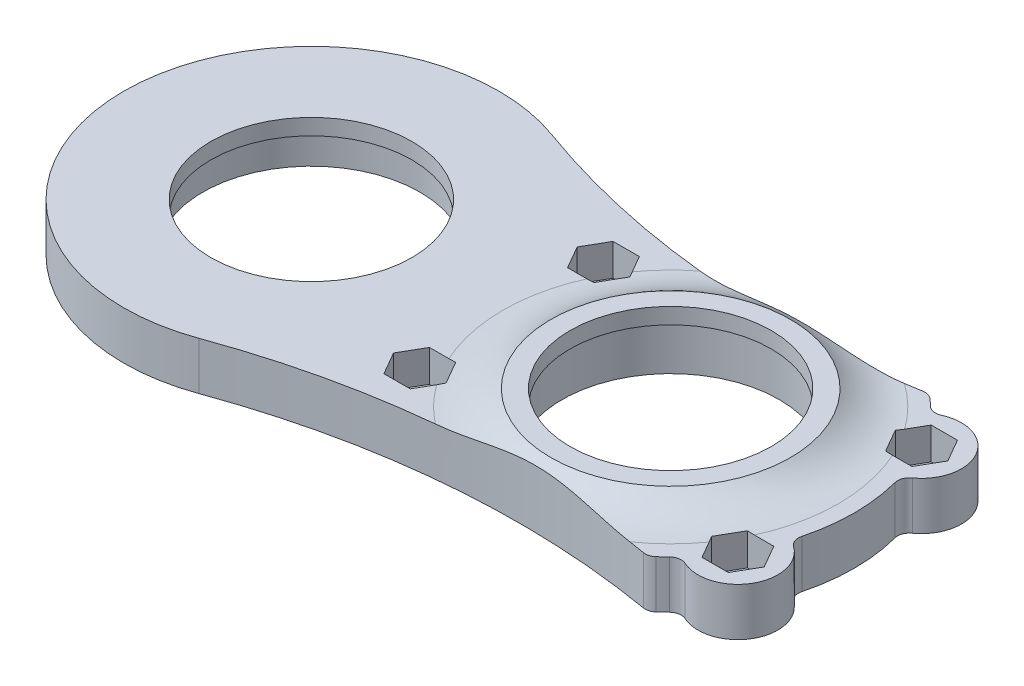
from build123d import *

# Parameters (mm, degrees)
SKETCH_1_R               = 23
SKETCH_1_R_2             = 13.6
SKETCH_1_R_3             = 5
EXTRUDE_1_DEPTH          = 6
CUT_EXTRUDE_1_DEPTH      = 14
PATTERN_CIRCULAR_1_COUNT = 2
CUT_EXTRUDE_START        = -7
CUT_EXTRUDE_2_DEPTH      = 7
FILLET_1_R               = 1.5
CUT_EXTRUDE_4_DEPTH      = 4
PATTERN_CIRCULAR_2_COUNT = 6
SKETCH_9_R               = 13.6
SKETCH_9_R_2             = 12.6
EXTRUDE_5_DEPTH          = 2
EXTRUDE_START            = -6
SKETCH_12_R              = 13.6
EXTRUDE_6_DEPTH          = 6
CUT_EXTRUDE_5_DEPTH      = 10
SKETCH_17_R              = 13.6
SKETCH_17_R_2            = 12.6
EXTRUDE_7_DEPTH          = 2
EXTRUDE_START_2          = 2
SKETCH_18_R              = 15
SKETCH_18_R_2            = 13.6
EXTRUDE_8_DEPTH          = 2
SKETCH_19_R              = 13.6
CUT_EXTRUDE_6_DEPTH      = 2
SKETCH_20_R              = 13.6
SKETCH_20_R_2            = 12.6
EXTRUDE_9_DEPTH          = 2
FILLET_2_R               = 10


with BuildPart() as part:
    # 草图1 → 凸台-拉伸1 (new body)
    # profile 1 of 5: a face of its own
    with BuildSketch(Plane(origin=(0, 0, 0), x_dir=(1, 0, 0), z_dir=(0, 1, 0))):
        Circle(SKETCH_1_R)
        with Locations(Location((0, 0, 0), (0, 0, 270))):
            Circle(SKETCH_1_R_2, mode=Mode.SUBTRACT)
    # profile 2 of 5: a face of its own
    with BuildSketch(Plane(origin=(0, 0, 0), x_dir=(1, 0, 0), z_dir=(0, 1, 0))):
        with Locations((-19.918584287, -11.5)):
            Circle(SKETCH_1_R_3)
    # profile 3 of 5: a face of its own
    with BuildSketch(Plane(origin=(0, 0, 0), x_dir=(1, 0, 0), z_dir=(0, 1, 0))):
        with Locations((19.918584287, -11.5)):
            Circle(SKETCH_1_R_3)
    # profile 4 of 5: a face of its own
    with BuildSketch(Plane(origin=(0, 0, 0), x_dir=(1, 0, 0), z_dir=(0, 1, 0))):
        with Locations((19.918584287, 11.5)):
            Circle(SKETCH_1_R_3)
    # profile 5 of 5: a face of its own
    with BuildSketch(Plane(origin=(0, 0, 0), x_dir=(1, 0, 0), z_dir=(0, 1, 0))):
        with Locations((-19.918584287, 11.5)):
            Circle(SKETCH_1_R_3)
    extrude(amount=-EXTRUDE_1_DEPTH)

    # 草图2 → 切除-拉伸1 (cut)
    with BuildSketch(Plane.XZ.offset(6)):
        with BuildLine():
            ThreePointArc((-19.918584287, 9.9), (-18.787213437, 10.36862915), (-18.318584287, 11.5))
            Line((-18.318584287, 11.5), (-19.918584287, 11.5))
            Line((-19.918584287, 11.5), (-19.918584287, 9.9))
        make_face()
        with BuildLine():
            Line((-19.918584287, 11.5), (-18.318584287, 11.5))
            ThreePointArc((-18.318584287, 11.5), (-21.049955137, 12.63137085), (-19.918584287, 9.9))
            Line((-19.918584287, 9.9), (-19.918584287, 11.5))
        make_face()
        with BuildLine():
            ThreePointArc((-19.918584287, 9.9), (-18.787213437, 10.36862915), (-18.318584287, 11.5))
            Line((-18.318584287, 11.5), (-19.918584287, 11.5))
            Line((-19.918584287, 11.5), (-19.918584287, 9.9))
        make_face()
        with BuildLine():
            Line((-19.918584287, 11.5), (-18.318584287, 11.5))
            ThreePointArc((-18.318584287, 11.5), (-21.049955137, 12.63137085), (-19.918584287, 9.9))
            Line((-19.918584287, 9.9), (-19.918584287, 11.5))
        make_face()
        with BuildLine():
            ThreePointArc((-19.918584287, -9.9), (-21.049955137, -12.63137085), (-18.318584287, -11.5))
            Line((-18.318584287, -11.5), (-19.918584287, -11.5))
            Line((-19.918584287, -11.5), (-19.918584287, -9.9))
        make_face()
        with BuildLine():
            Line((-19.918584287, -11.5), (-18.318584287, -11.5))
            ThreePointArc((-18.318584287, -11.5), (-18.787213437, -10.36862915), (-19.918584287, -9.9))
            Line((-19.918584287, -9.9), (-19.918584287, -11.5))
        make_face()
        with BuildLine():
            ThreePointArc((-19.918584287, -9.9), (-21.049955137, -12.63137085), (-18.318584287, -11.5))
            Line((-18.318584287, -11.5), (-19.918584287, -11.5))
            Line((-19.918584287, -11.5), (-19.918584287, -9.9))
        make_face()
        with BuildLine():
            Line((-19.918584287, -11.5), (-18.318584287, -11.5))
            ThreePointArc((-18.318584287, -11.5), (-18.787213437, -10.36862915), (-19.918584287, -9.9))
            Line((-19.918584287, -9.9), (-19.918584287, -11.5))
        make_face()
    cut_extrude_1 = extrude(amount=-CUT_EXTRUDE_1_DEPTH, mode=Mode.SUBTRACT)

    # 阵列(圆周)1: 切除-拉伸1 ×2 about axis
    pattern_circular_1_axis = Axis((0, 0, 0), (0, 1, 0))
    for i in range(1, PATTERN_CIRCULAR_1_COUNT):
        add(cut_extrude_1.rotate(pattern_circular_1_axis, i * 360 / PATTERN_CIRCULAR_1_COUNT), mode=Mode.SUBTRACT)

    # 草图3 → 切除-拉伸2 (cut)
    with BuildSketch(Plane.XZ.offset(6).offset(CUT_EXTRUDE_START)):
        with BuildLine():
            ThreePointArc((14.774295945, 17.627256716), (-0.556308738, 22.993271202), (-15.609472524, 16.892139223))
            ThreePointArc((-15.609472524, 16.892139223), (-0.389497448, 16.098651419), (14.774295945, 17.627256716))
        make_face()
        with BuildLine():
            ThreePointArc((-15.609472524, -16.892139223), (-0.556308738, -22.993271202), (14.774295945, -17.627256716))
            ThreePointArc((14.774295945, -17.627256716), (-0.389497448, -16.098651419), (-15.609472524, -16.892139223))
        make_face()
    extrude(amount=CUT_EXTRUDE_2_DEPTH, mode=Mode.SUBTRACT)

    # 圆角1
    fillet_1_edges = [part.edges().sort_by_distance(p)[0] for p in [
        (16.962730619, -3, 15.532732212),
        (-16.962730619, -3, 15.532732212),
        (-21.933105995, -3, 6.923789527),
        (-21.933105995, -3, -6.923789527),
        (-16.962730619, -3, -15.532732212),
        (16.962730619, -3, -15.532732212),
        (21.933105995, -3, -6.923789527),
        (21.933105995, -3, 6.923789527),
        (-15.609472524, -3, 16.892139223),
        (14.774295945, -3, 17.627256716),
        (14.774295945, -3, -17.627256716),
        (-15.609472524, -3, -16.892139223),
    ]]
    fillet(fillet_1_edges, radius=FILLET_1_R)

    # 草图8 → 切除-拉伸4 (cut)
    with BuildSketch(Plane(origin=(0, 0, 0), x_dir=(1, 0, 0), z_dir=(0, 1, 0))):
        Polygon((-16.627687753, 11.5), (-18.27313602, 14.35), (-21.564032554, 14.35), (-23.209480821, 11.5), (-21.564032554, 8.65), (-18.27313602, 8.65), align=None)
        Polygon((-16.627687753, -11.5), (-18.27313602, -8.65), (-21.564032554, -8.65), (-23.209480821, -11.5), (-21.564032554, -14.35), (-18.27313602, -14.35), align=None)
    cut_extrude_4 = extrude(amount=-CUT_EXTRUDE_4_DEPTH, mode=Mode.SUBTRACT)

    # 阵列(圆周)2: 切除-拉伸4 ×6 about axis
    pattern_circular_2_axis = Axis((0, -6, 0), (0, 1, 0))
    for i in range(1, PATTERN_CIRCULAR_2_COUNT):
        add(cut_extrude_4.rotate(pattern_circular_2_axis, i * 360 / PATTERN_CIRCULAR_2_COUNT), mode=Mode.SUBTRACT)

    # 草图9 → 凸台-拉伸5 (add)
    with BuildSketch(Plane(origin=(0, 0, 0), x_dir=(1, 0, 0), z_dir=(0, 1, 0))):
        with Locations(Location((0, 0, 0), (0, 0, 270))):
            Circle(SKETCH_9_R)
        with Locations(Location((0, 0, 0), (0, 0, 270))):
            Circle(SKETCH_9_R_2, mode=Mode.SUBTRACT)
    extrude(amount=-EXTRUDE_5_DEPTH)

    # 草图12 → 凸台-拉伸6 (add)
    with BuildSketch(Plane.XZ.offset(6).offset(EXTRUDE_START)):
        with BuildLine():
            ThreePointArc((-22.248260717, -5.832228997), (-22.811291025, -2.940238384), (-23, 0))
            ThreePointArc((-23, 0), (-22.811291025, 2.940238384), (-22.248260717, 5.832228997))
            add(Edge.make_bspline(
                [(-22.248260717, 5.832228997), (-22.226619665, 5.914783328), (-22.210406286, 6.000567583), (-22.200301184, 6.08895497), (-22.196856608, 6.179069987), (-22.203815662, 6.361083038), (-22.214272651, 6.452988829), (-22.231966608, 6.544597585), (-22.256853878, 6.634773116), (-22.320260087, 6.810194045), (-22.358779966, 6.895442045), (-22.403747133, 6.97719285), (-22.454468707, 7.054544935), (-22.565491839, 7.198943839), (-22.625757329, 7.266030738), (-22.690039488, 7.327530717), (-22.757353921, 7.383123694), (-22.82677656, 7.432762891)],
                knots=[0, 0, 0, 0, 0, 0, 0.249516802, 0.249516802, 0.249516802, 0.249516802, 0.5, 0.5, 0.5, 0.5, 0.750483198, 0.750483198, 0.750483198, 0.750483198, 1, 1, 1, 1, 1, 1], degree=5))
            ThreePointArc((-22.82677656, 7.432762891), (-24.248711306, 14), (-17.850349764, 16.052186942))
            add(Edge.make_bspline(
                [(-16.174988831, 16.351444472), (-16.235662453, 16.291425606), (-16.301847107, 16.234492281), (-16.373340279, 16.181547312), (-16.449659884, 16.133506713), (-16.610767338, 16.048526906), (-16.695588582, 16.011630028), (-16.78377107, 15.981149066), (-16.874309005, 15.957614309), (-17.057931091, 15.924815232), (-17.151017964, 15.915550426), (-17.244299822, 15.913617732), (-17.336649479, 15.918867862), (-17.517214164, 15.942817262), (-17.605445868, 15.961465258), (-17.690847492, 15.986385251), (-17.772649638, 16.016884771), (-17.850349764, 16.052186942)],
                knots=[0, 0, 0, 0, 0, 0, 0.249516802, 0.249516802, 0.249516802, 0.249516802, 0.5, 0.5, 0.5, 0.5, 0.750483198, 0.750483198, 0.750483198, 0.750483198, 1, 1, 1, 1, 1, 1], degree=5))
            ThreePointArc((-16.174988831, 16.351444472), (-16.158686082, 16.367555227), (-16.142367286, 16.383649728))
            add(Edge.make_bspline(
                [(-14.908106077, 16.804129822), (-14.972885852, 16.81202611), (-15.038864386, 16.816493362), (-15.105701752, 16.817319749), (-15.172995405, 16.814358801), (-15.307724426, 16.800752886), (-15.375160188, 16.790098491), (-15.442197946, 16.775544774), (-15.508388889, 16.75713699), (-15.638241935, 16.712899498), (-15.701904385, 16.687069671), (-15.763884644, 16.657670367), (-15.823799619, 16.62493974), (-15.938814144, 16.553464646), (-15.993919762, 16.514727405), (-16.046351845, 16.473269076), (-16.09588099, 16.429451419), (-16.142367286, 16.383649728)],
                knots=[0, 0, 0, 0, 0, 0, 0.2498464, 0.2498464, 0.2498464, 0.2498464, 0.5, 0.5, 0.5, 0.5, 0.7501536, 0.7501536, 0.7501536, 0.7501536, 1, 1, 1, 1, 1, 1], degree=5))
            ThreePointArc((-14.908106077, 16.804129822), (-11.733789584, 16.468520252), (-8.550378912, 16.234393207))
            Line((-8.550378912, 16.234393207), (-8.550378912, 23.501770851))
            Line((-8.550378912, 23.501770851), (-81.449621088, 23.501770851))
            Line((-81.449621088, 23.501770851), (-81.449621088, -23.501770851))
            Line((-81.449621088, -23.501770851), (-8.550378912, -23.501770851))
            Line((-8.550378912, -23.501770851), (-8.550378912, -16.234393207))
            ThreePointArc((-8.550378912, -16.234393207), (-11.733789584, -16.468520252), (-14.908106077, -16.804129822))
            add(Edge.make_bspline(
                [(-14.908106077, -16.804129822), (-14.972885852, -16.81202611), (-15.038864386, -16.816493362), (-15.105701752, -16.817319749), (-15.172995405, -16.814358801), (-15.307724426, -16.800752886), (-15.375160188, -16.790098491), (-15.442197946, -16.775544774), (-15.508388889, -16.75713699), (-15.638241935, -16.712899498), (-15.701904385, -16.687069671), (-15.763884644, -16.657670367), (-15.823799619, -16.62493974), (-15.938814144, -16.553464646), (-15.993919762, -16.514727405), (-16.046351845, -16.473269076), (-16.09588099, -16.429451419), (-16.142367286, -16.383649728)],
                knots=[0, 0, 0, 0, 0, 0, 0.2498464, 0.2498464, 0.2498464, 0.2498464, 0.5, 0.5, 0.5, 0.5, 0.7501536, 0.7501536, 0.7501536, 0.7501536, 1, 1, 1, 1, 1, 1], degree=5))
            ThreePointArc((-16.142367286, -16.383649728), (-16.158686082, -16.367555227), (-16.174988831, -16.351444472))
            add(Edge.make_bspline(
                [(-17.850349764, -16.052186942), (-17.772649638, -16.016884771), (-17.690847492, -15.986385251), (-17.605445868, -15.961465258), (-17.517214164, -15.942817262), (-17.336649479, -15.918867862), (-17.244299822, -15.913617732), (-17.151017964, -15.915550426), (-17.057931091, -15.924815232), (-16.874309005, -15.957614309), (-16.78377107, -15.981149066), (-16.695588582, -16.011630028), (-16.610767338, -16.048526906), (-16.449659884, -16.133506713), (-16.373340279, -16.181547312), (-16.301847107, -16.234492281), (-16.235662453, -16.291425606), (-16.174988831, -16.351444472)],
                knots=[0, 0, 0, 0, 0, 0, 0.249516802, 0.249516802, 0.249516802, 0.249516802, 0.5, 0.5, 0.5, 0.5, 0.750483198, 0.750483198, 0.750483198, 0.750483198, 1, 1, 1, 1, 1, 1], degree=5))
            ThreePointArc((-17.850349764, -16.052186942), (-24.248711306, -14), (-22.82677656, -7.432762891))
            add(Edge.make_bspline(
                [(-22.248260717, -5.832228997), (-22.226619665, -5.914783328), (-22.210406286, -6.000567583), (-22.200301184, -6.08895497), (-22.196856608, -6.179069987), (-22.203815662, -6.361083038), (-22.214272651, -6.452988829), (-22.231966608, -6.544597585), (-22.256853878, -6.634773116), (-22.320260087, -6.810194045), (-22.358779966, -6.895442045), (-22.403747133, -6.97719285), (-22.454468707, -7.054544935), (-22.565491839, -7.198943839), (-22.625757329, -7.266030738), (-22.690039488, -7.327530717), (-22.757353921, -7.383123694), (-22.82677656, -7.432762891)],
                knots=[0, 0, 0, 0, 0, 0, 0.249516802, 0.249516802, 0.249516802, 0.249516802, 0.5, 0.5, 0.5, 0.5, 0.750483198, 0.750483198, 0.750483198, 0.750483198, 1, 1, 1, 1, 1, 1], degree=5))
        make_face()
        with Locations(Location((-45, 0, 0), (0, 0, 270))):
            Circle(SKETCH_12_R, mode=Mode.SUBTRACT)
    extrude(amount=EXTRUDE_6_DEPTH)

    # 草图15 → 切除-拉伸5 (cut)
    with BuildSketch(Plane(origin=(0, 0, 0), x_dir=(1, 0, 0), z_dir=(0, 1, 0))):
        with BuildLine():
            Line((-8.550378912, -23.501770851), (-8.550378912, -16.234393207))
            ThreePointArc((-8.550378912, -16.234393207), (-22.974373049, -18.123866434), (-36.971607829, -22.08607976))
            ThreePointArc((-36.971607829, -22.08607976), (-68.5, 7.94e-07), (-36.971606336, 22.086079217))
            ThreePointArc((-36.971606336, 22.086079217), (-22.974372271, 18.123866274), (-8.550378912, 16.234393207))
            Line((-8.550378912, 16.234393207), (-8.550378912, 23.501770851))
            Line((-8.550378912, 23.501770851), (-81.449621088, 23.501770851))
            Line((-81.449621088, 23.501770851), (-81.449621088, -23.501770851))
            Line((-81.449621088, -23.501770851), (-8.550378912, -23.501770851))
        make_face()
    extrude(amount=-CUT_EXTRUDE_5_DEPTH, mode=Mode.SUBTRACT)

    # 草图17 → 凸台-拉伸7 (add)
    with BuildSketch(Plane(origin=(0, 0, 0), x_dir=(1, 0, 0), z_dir=(0, 1, 0))):
        with Locations(Location((-45, 0, 0), (0, 0, 90))):
            Circle(SKETCH_17_R)
        with Locations(Location((-45, 0, 0), (0, 0, 270))):
            Circle(SKETCH_17_R_2, mode=Mode.SUBTRACT)
    extrude(amount=-EXTRUDE_7_DEPTH)

    # 草图18 → 凸台-拉伸8 (add)
    with BuildSketch(Plane(origin=(0, 0, 0), x_dir=(1, 0, 0), z_dir=(0, 1, 0)).offset(EXTRUDE_START_2)):
        with Locations(Location((0, 0, 0), (0, 0, 270))):
            Circle(SKETCH_18_R)
        with Locations(Location((0, 0, 0), (0, 0, 270))):
            Circle(SKETCH_18_R_2, mode=Mode.SUBTRACT)
    extrude(amount=-EXTRUDE_8_DEPTH)

    # 草图19 → 切除-拉伸6 (cut)
    with BuildSketch(Plane(origin=(0, 0, 0), x_dir=(1, 0, 0), z_dir=(0, 1, 0))):
        with Locations(Location((0, 0, 0), (0, 0, 270))):
            Circle(SKETCH_19_R)
    extrude(amount=-CUT_EXTRUDE_6_DEPTH, mode=Mode.SUBTRACT)


with BuildPart() as body_2:
    # 草图20 → 凸台-拉伸9 (new body)
    with BuildSketch(Plane(origin=(0, 2, 0), x_dir=(1, 0, 0), z_dir=(0, 1, 0))):
        with Locations(Location((0, 0, 0), (0, 0, 270))):
            Circle(SKETCH_20_R)
        with Locations(Location((0, 0, 0), (0, 0, 270))):
            Circle(SKETCH_20_R_2, mode=Mode.SUBTRACT)
    extrude(amount=-EXTRUDE_9_DEPTH)

    # Combine 1: union part
    add(part.part)

    # 圆角2
    # the kernel refuses this fillet: 10 mm, written as the material it adds along each edge
    with BuildSketch(Plane(origin=(0, 0, 0), x_dir=(0, 0, 1), z_dir=(-1, 0, 0))) as fillet_2_piece_1_section:
        with BuildLine():
            CenterArc((21, 10), FILLET_2_R, 233.130102354, 36.869897646)
            Line((15, 2), (15, 0))
            Line((15, 0), (21, 0))
        make_face()
    fillet_2_piece_1 = revolve(axis=Axis((0, 0, 0), (0, 1, 0)), mode=Mode.PRIVATE)
    fillet_2_piece_1 = fillet_2_piece_1 - Plane(origin=(-2.80823109, 0, 116.069395778), x_dir=(-0.12801241433859908, 0, -0.9917725655487768), z_dir=(0, 1, 0)) * Cylinder(100, 85, mode=Mode.PRIVATE)
    fillet_2_piece_1 = fillet_2_piece_1 - Plane(origin=(-2.80823109, 0, -116.069395778), x_dir=(-0.34163375246116695, 0, 0.9398331656093555), z_dir=(0, 1, 0)) * Cylinder(100, 85, mode=Mode.PRIVATE)
    fillet_2_piece_1 = split(fillet_2_piece_1, bisect_by=Plane(origin=(-17.450411886, 0, 10.075), z_dir=(0.8660254037844383, 0, -0.5000000000000009)), keep=Keep.TOP, mode=Mode.PRIVATE)
    fillet_2_piece_1 = split(fillet_2_piece_1, bisect_by=Plane(origin=(17.450411886, 0, 10.075), z_dir=(-0.866025403784439, 0, -0.49999999999999933)), keep=Keep.TOP, mode=Mode.PRIVATE)
    fillet_2_piece_1 = split(fillet_2_piece_1, bisect_by=Plane(origin=(-17.450411886, 0, -10.075), z_dir=(0.8660254037844385, 0, 0.5000000000000002)), keep=Keep.TOP, mode=Mode.PRIVATE)
    fillet_2_piece_1 = split(fillet_2_piece_1, bisect_by=Plane(origin=(17.450411886, 0, -10.075), z_dir=(-0.8660254037844382, 0, 0.5000000000000007)), keep=Keep.TOP, mode=Mode.PRIVATE)
    add(fillet_2_piece_1)
    with BuildSketch(Plane(origin=(0, 0, 0), x_dir=(0, 0, 1), z_dir=(-1, 0, 0))) as fillet_2_piece_2_section:
        with BuildLine():
            CenterArc((21, 10), FILLET_2_R, 233.130102354, 36.869897646)
            Line((15, 2), (15, 0))
            Line((15, 0), (21, 0))
        make_face()
    fillet_2_piece_2 = revolve(axis=Axis((0, 0, 0), (0, 1, 0)), mode=Mode.PRIVATE)
    fillet_2_piece_2 = fillet_2_piece_2 - Plane(origin=(-2.80823109, 0, 116.069395778), x_dir=(-0.12801241433859908, 0, -0.9917725655487768), z_dir=(0, 1, 0)) * Cylinder(100, 85, mode=Mode.PRIVATE)
    fillet_2_piece_2 = split(fillet_2_piece_2, bisect_by=Plane(origin=(-17.450411886, 0, 10.075), z_dir=(0.8660254037844383, 0, -0.5000000000000009)), keep=Keep.TOP, mode=Mode.PRIVATE)
    fillet_2_piece_2 = split(fillet_2_piece_2, bisect_by=Plane(origin=(7.491119743, 0, -4.325), z_dir=(-0.8660254037844388, 0, 0.49999999999999983)), keep=Keep.TOP, mode=Mode.PRIVATE)
    fillet_2_piece_2 = split(fillet_2_piece_2, bisect_by=Plane(origin=(0, 0, -8.65), z_dir=(0, 0, 1)), keep=Keep.TOP, mode=Mode.PRIVATE)
    add(fillet_2_piece_2)
    with BuildSketch(Plane(origin=(0, 0, 0), x_dir=(0, 0, 1), z_dir=(-1, 0, 0))) as fillet_2_piece_3_section:
        with BuildLine():
            CenterArc((21, 10), FILLET_2_R, 233.130102354, 36.869897646)
            Line((15, 2), (15, 0))
            Line((15, 0), (21, 0))
        make_face()
    fillet_2_piece_3 = revolve(axis=Axis((0, 0, 0), (0, 1, 0)), mode=Mode.PRIVATE)
    fillet_2_piece_3 = fillet_2_piece_3 - Plane(origin=(-2.80823109, 0, 116.069395778), x_dir=(-0.12801241433859908, 0, -0.9917725655487768), z_dir=(0, 1, 0)) * Cylinder(100, 85, mode=Mode.PRIVATE)
    fillet_2_piece_3 = fillet_2_piece_3 - Plane(origin=(-2.80823109, 0, -116.069395778), x_dir=(-0.34163375246116695, 0, 0.9398331656093555), z_dir=(0, 1, 0)) * Cylinder(100, 85, mode=Mode.PRIVATE)
    fillet_2_piece_3 = split(fillet_2_piece_3, bisect_by=Plane(origin=(-7.491119743, 0, -4.325), z_dir=(0.8660254037844384, 0, 0.5000000000000007)), keep=Keep.TOP, mode=Mode.PRIVATE)
    fillet_2_piece_3 = split(fillet_2_piece_3, bisect_by=Plane(origin=(7.491119743, 0, 4.325), z_dir=(-0.8660254037844383, 0, -0.5000000000000008)), keep=Keep.TOP, mode=Mode.PRIVATE)
    add(fillet_2_piece_3)
    with BuildSketch(Plane(origin=(0, 0, 0), x_dir=(0, 0, 1), z_dir=(-1, 0, 0))) as fillet_2_piece_4_section:
        with BuildLine():
            CenterArc((21, 10), FILLET_2_R, 233.130102354, 36.869897646)
            Line((15, 2), (15, 0))
            Line((15, 0), (21, 0))
        make_face()
    fillet_2_piece_4 = revolve(axis=Axis((0, 0, 0), (0, 1, 0)), mode=Mode.PRIVATE)
    fillet_2_piece_4 = split(fillet_2_piece_4, bisect_by=Plane(origin=(0, 0, 8.65), z_dir=(0, 0, -1)), keep=Keep.TOP, mode=Mode.PRIVATE)
    fillet_2_piece_4 = split(fillet_2_piece_4, bisect_by=Plane(origin=(0, 0, -8.65), z_dir=(0, 0, 1)), keep=Keep.TOP, mode=Mode.PRIVATE)
    add(fillet_2_piece_4)
    with BuildSketch(Plane(origin=(0, 0, 0), x_dir=(0, 0, 1), z_dir=(-1, 0, 0))) as fillet_2_piece_5_section:
        with BuildLine():
            CenterArc((21, 10), FILLET_2_R, 233.130102354, 36.869897646)
            Line((15, 2), (15, 0))
            Line((15, 0), (21, 0))
        make_face()
    fillet_2_piece_5 = revolve(axis=Axis((0, 0, 0), (0, 1, 0)), mode=Mode.PRIVATE)
    fillet_2_piece_5 = split(fillet_2_piece_5, bisect_by=Plane(origin=(-7.491119743, 0, 4.325), z_dir=(0.8660254037844384, 0, -0.5000000000000004)), keep=Keep.TOP, mode=Mode.PRIVATE)
    fillet_2_piece_5 = split(fillet_2_piece_5, bisect_by=Plane(origin=(-17.450411886, 0, -10.075), z_dir=(-0.8660254037844385, 0, -0.5000000000000002)), keep=Keep.TOP, mode=Mode.PRIVATE)
    add(fillet_2_piece_5)


solid = body_2.part
